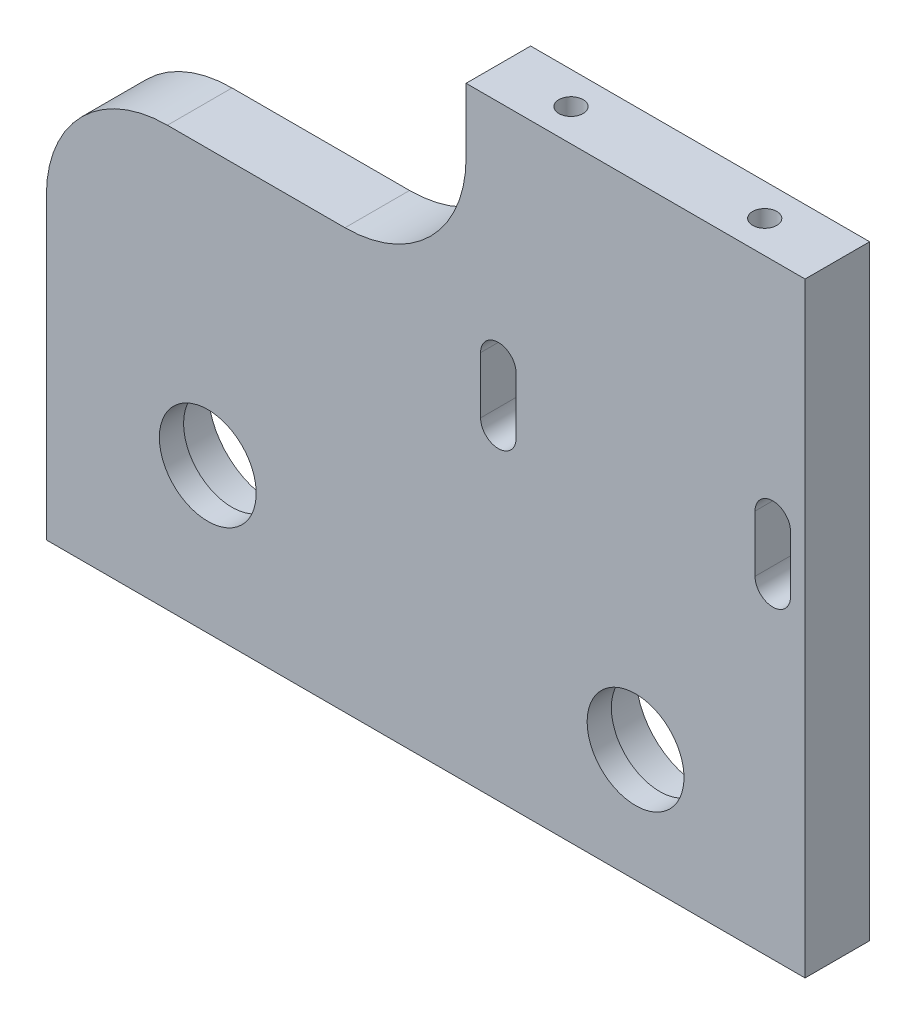
from build123d import *

# Parameters (mm, degrees)
BOSS_EXTRU_1_DEPTH      = 8
ESQUISSE2_R             = 7.95
ENL_V_MAT_EXTRU_1_DEPTH = 5
ESQUISSE3_R             = 6
ENL_V_MAT_EXTRU_2_DEPTH = 121.357799913
ENL_V_MAT_EXTRU_3_DEPTH = 121.519707932
ESQUISSE5_R             = 1.5
ENL_V_MAT_EXTRU_4_DEPTH = 30
CONG_1_R                = 15
ESQUISSE6_R             = 1.5
ENL_V_MAT_EXTRU_5_DEPTH = 20


with BuildPart() as part:
    # Esquisse1 → Boss.-Extru.1 (new body)
    with BuildSketch(Plane.XY):
        Polygon((52, 75), (52, 52), (0, 52), (0, 0), (94, 0), (94, 75), align=None)
    extrude(amount=BOSS_EXTRU_1_DEPTH)

    # Esquisse2 → Enlèv. mat.-Extru.1 (cut)
    with BuildSketch(Plane(origin=(0, 0, 0), x_dir=(-1, 0, 0), z_dir=(0, 0, -1))):
        with Locations((-20, 18)):
            Circle(ESQUISSE2_R)
        with Locations((-73, 14)):
            Circle(ESQUISSE2_R)
    extrude(amount=-ENL_V_MAT_EXTRU_1_DEPTH, mode=Mode.SUBTRACT)

    # Esquisse3 → Enlèv. mat.-Extru.2 (cut, through all)
    with BuildSketch(Plane(origin=(0, 0, 5), x_dir=(-1, 0, 0), z_dir=(0, 0, -1))):
        with Locations((-73, 14)):
            Circle(ESQUISSE3_R)
        with Locations((-20, 18)):
            Circle(ESQUISSE3_R)
    extrude(amount=-ENL_V_MAT_EXTRU_2_DEPTH, mode=Mode.SUBTRACT)

    # Esquisse4 → Enlèv. mat.-Extru.3 (cut, through all)
    with BuildSketch(Plane(origin=(0, 0, 0), x_dir=(-1, 0, 0), z_dir=(0, 0, -1))):
        with BuildLine():
            Line((-92.2, 40), (-92.2, 47))
            ThreePointArc((-92.2, 47), (-90, 49.2), (-87.8, 47))
            Line((-87.8, 47), (-87.8, 40))
            ThreePointArc((-87.8, 40), (-90, 37.8), (-92.2, 40))
        make_face()
        with BuildLine():
            Line((-53.8, 40), (-53.8, 47))
            ThreePointArc((-53.8, 47), (-56, 49.2), (-58.2, 47))
            Line((-58.2, 47), (-58.2, 40))
            ThreePointArc((-58.2, 40), (-56, 37.8), (-53.8, 40))
        make_face()
    extrude(amount=-ENL_V_MAT_EXTRU_3_DEPTH, mode=Mode.SUBTRACT)

    # Esquisse5 → Enlèv. mat.-Extru.4 (cut)
    with BuildSketch(Plane(origin=(0, 75, 0), x_dir=(1, 0, 0), z_dir=(0, 1, 0))):
        with Locations((61, -4)):
            Circle(ESQUISSE5_R)
        with Locations((85, -4)):
            Circle(ESQUISSE5_R)
    extrude(amount=-ENL_V_MAT_EXTRU_4_DEPTH, mode=Mode.SUBTRACT)

    # Congé1
    cong_1_edges = [part.edges().sort_by_distance(p)[0] for p in [
        (0, 52, 4),
        (52, 52, 4),
    ]]
    fillet(cong_1_edges, radius=CONG_1_R)

    # Esquisse6 → Enlèv. mat.-Extru.5 (cut)
    with BuildSketch(Plane.XZ):
        with Locations((6, 4)):
            Circle(ESQUISSE6_R)
        with Locations((88, 4)):
            Circle(ESQUISSE6_R)
    extrude(amount=-ENL_V_MAT_EXTRU_5_DEPTH, mode=Mode.SUBTRACT)


solid = part.part
